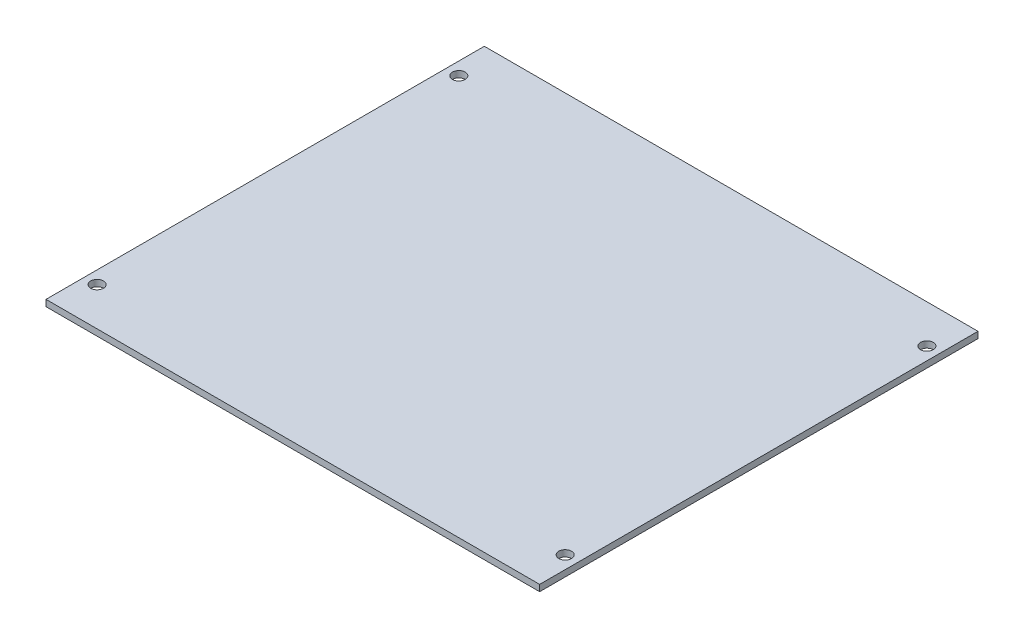
from build123d import *

# Parameters (mm, degrees)
SKETCH_1_W      = 116
SKETCH_1_H      = 103
SKETCH_1_R      = 1.5
EXTRUDE_1_DEPTH = 1.5


with BuildPart() as part:
    # Эскиз1 → Бобышка-Вытянуть1 (new body)
    with BuildSketch(Plane(origin=(0, 0, 0), x_dir=(1, 0, 0), z_dir=(0, 1, 0))):
        Rectangle(SKETCH_1_W, SKETCH_1_H)
        with Locations((-55, 42.5)):
            Circle(SKETCH_1_R, mode=Mode.SUBTRACT)
        with Locations((55, 42.5)):
            Circle(SKETCH_1_R, mode=Mode.SUBTRACT)
        with Locations((55, -42.5)):
            Circle(SKETCH_1_R, mode=Mode.SUBTRACT)
        with Locations((-55, -42.5)):
            Circle(SKETCH_1_R, mode=Mode.SUBTRACT)
    extrude(amount=EXTRUDE_1_DEPTH)


solid = part.part
